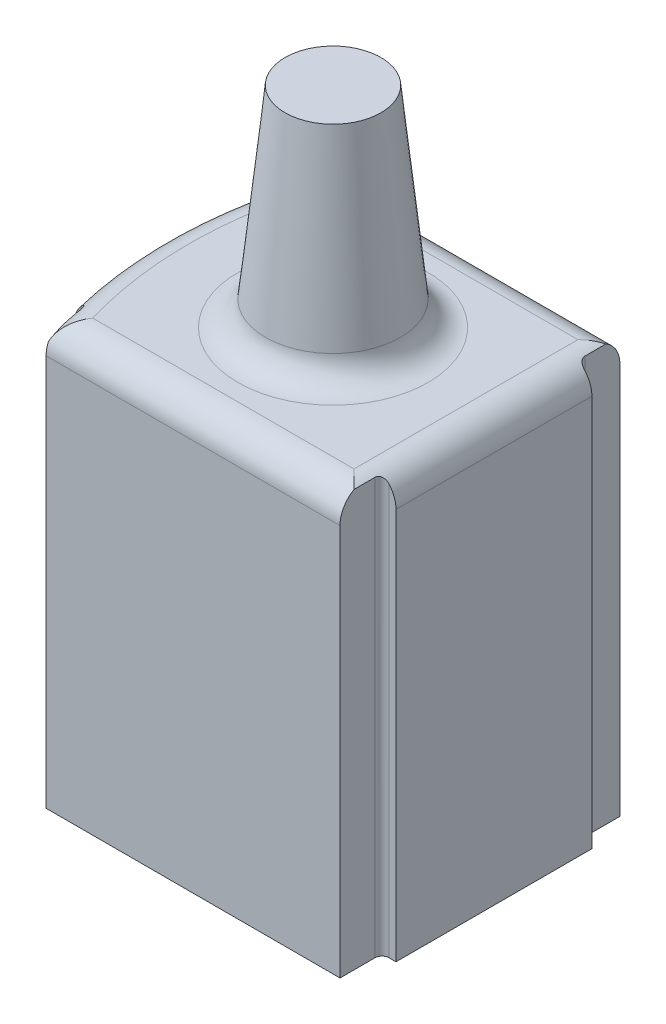
from build123d import *

# Parameters (mm, degrees)
SALIENTE_EXTRUIR1_DEPTH = 30
CROQUIS2_R              = 5
SALIENTE_EXTRUIR2_DEPTH = 15
SALIENTE_EXTRUIR2_TAPER = 6
REDONDEO1_R             = 2
REDONDEO2_R             = 2


with BuildPart() as part:
    # Croquis1 → Saliente-Extruir1 (new body)
    with BuildSketch(Plane(origin=(0, 0, 0), x_dir=(1, 0, 0), z_dir=(0, 1, 0))):
        with BuildLine():
            Line((0, 2.5), (0, 0))
            Line((0, 0), (10.5, 0))
            Line((10.5, 0), (10.5, 20))
            Line((10.5, 20), (0, 20))
            Line((0, 20), (0, 17.5))
            ThreePointArc((0, 17.5), (-0.146446609, 17.146446609), (-0.5, 17))
            Line((-0.5, 17), (-1, 17))
            ThreePointArc((-1, 17), (-1.828095708, 10), (-1, 3))
            Line((-1, 3), (-0.5, 3))
            ThreePointArc((-0.5, 3), (-0.146446609, 2.853553391), (0, 2.5))
        make_face()
        with BuildLine():
            Line((10.5, 20), (10.5, 0))
            Line((10.5, 0), (21, 0))
            Line((21, 0), (21, 2.5))
            ThreePointArc((21, 2.5), (21.146446609, 2.853553391), (21.5, 3))
            Line((21.5, 3), (22, 3))
            Line((22, 3), (22, 17))
            Line((22, 17), (21.5, 17))
            ThreePointArc((21.5, 17), (21.146446609, 17.146446609), (21, 17.5))
            Line((21, 17.5), (21, 20))
            Line((21, 20), (10.5, 20))
        make_face()
    extrude(amount=SALIENTE_EXTRUIR1_DEPTH)

    # Croquis2 → Saliente-Extruir2 (add)
    with BuildSketch(Plane(origin=(0, 30, 0), x_dir=(1, 0, 0), z_dir=(0, 1, 0))):
        with Locations((10.5, 10)):
            Circle(CROQUIS2_R)
    extrude(amount=SALIENTE_EXTRUIR2_DEPTH, taper=SALIENTE_EXTRUIR2_TAPER)

    # Redondeo1
    # the kernel refuses this fillet: 2 mm, written as the material it takes off along each edge
    with BuildSketch(Plane(origin=(26, 30, -20), x_dir=(0, 0, 1), z_dir=(-1, 0, 0)), Plane(origin=(-5, 30, 0), x_dir=(0, 0, -1), z_dir=(1, 0, 0))) as redondeo1_piece_1:
        with BuildLine():
            CenterArc((REDONDEO1_R, -REDONDEO1_R), REDONDEO1_R, 90, 90)
            Line((0, -REDONDEO1_R), (0, 0))
            Line((0, 0), (REDONDEO1_R, 0))
        make_face()
    extrude(amount=31, mode=Mode.SUBTRACT)
    with BuildSketch(Plane(origin=(22, 30, 2), x_dir=(-1, 0, 0), z_dir=(0, 0, -1))) as redondeo1_piece_2:
        with BuildLine():
            CenterArc((REDONDEO1_R, -REDONDEO1_R), REDONDEO1_R, 90, 90)
            Line((0, -REDONDEO1_R), (0, 0))
            Line((0, 0), (REDONDEO1_R, 0))
        make_face()
    extrude(amount=24, mode=Mode.SUBTRACT)
    with BuildSketch(Plane(origin=(28.171904292, 30, -10), x_dir=(-0.92021107903263, 0, -0.391422495553849), z_dir=(0.391422495553849, 0, -0.92021107903263))) as redondeo1_piece_3:
        with BuildLine():
            CenterArc((30 - REDONDEO1_R, -REDONDEO1_R), REDONDEO1_R, 0, 90)
            Line((30 - REDONDEO1_R, 0), (30, 0))
            Line((30, 0), (30, -REDONDEO1_R))
        make_face()
    revolve(axis=Axis((28.171904292, 30, -10), (0, 1, 0)), revolution_arc=46.086080448, mode=Mode.SUBTRACT)

    # Redondeo2
    redondeo2_edges = [part.edges().sort_by_distance(p)[0] for p in [
        (5.5, 30, -10),
    ]]
    fillet(redondeo2_edges, radius=REDONDEO2_R)


solid = part.part
